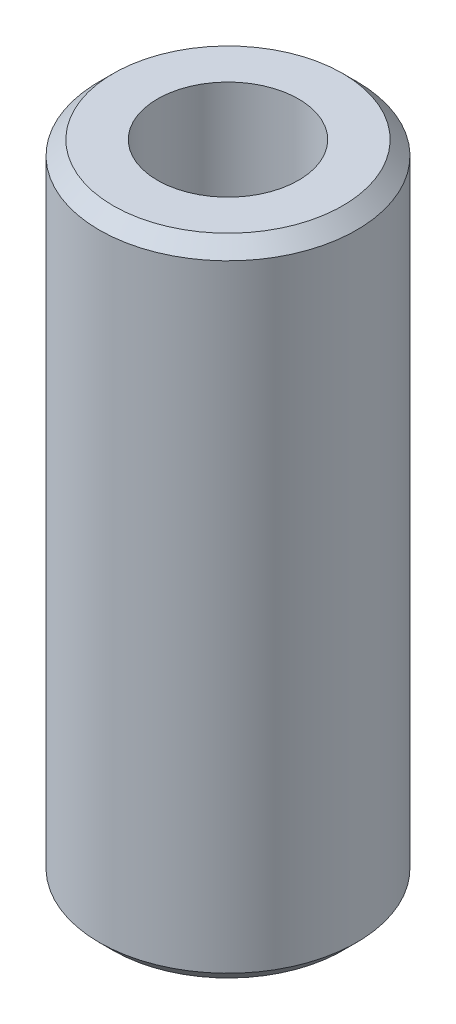
from build123d import *

# Parameters (mm, degrees)
SKETCH1_R           = 25
BOSS_EXTRUDE1_DEPTH = 125.306860111
SKETCH2_R           = 13.705110403
CUT_EXTRUDE1_DEPTH  = 131.199113633
CHAMFER1_SIZE       = 2.721122362


with BuildPart() as part:
    # Sketch1 → Boss-Extrude1 (new body)
    with BuildSketch(Plane(origin=(0, 0, 0), x_dir=(1, 0, 0), z_dir=(0, 1, 0))):
        Circle(SKETCH1_R)
    extrude(amount=BOSS_EXTRUDE1_DEPTH)

    # Sketch2 → Cut-Extrude1 (cut, through all)
    with BuildSketch(Plane(origin=(0, 0, 0), x_dir=(1, 0, 0), z_dir=(0, 1, 0))):
        Circle(SKETCH2_R)
    extrude(amount=CUT_EXTRUDE1_DEPTH, mode=Mode.SUBTRACT)

    # Chamfer1
    chamfer1_edges = [part.edges().sort_by_distance(p)[0] for p in [
        (-25, 125.306860111, 0),
        (-25, 0, 0),
    ]]
    chamfer(chamfer1_edges, length=CHAMFER1_SIZE)


solid = part.part
